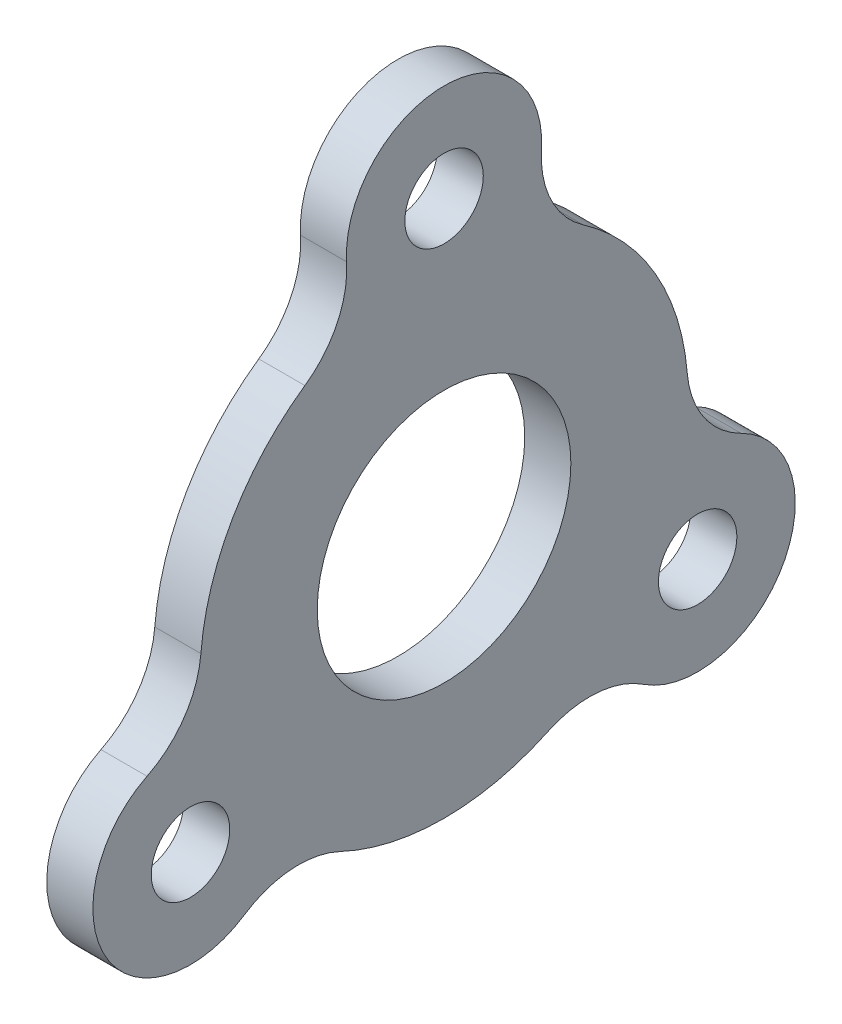
from build123d import *

# Parameters (mm, degrees)
SKETCH1_R           = 8.25000001
SKETCH1_R_2         = 2.5527
BOSS_EXTRUDE1_DEPTH = 3


with BuildPart() as part:
    # Sketch1 → Boss-Extrude1 (new body)
    with BuildSketch(Plane(origin=(0, 0, 0), x_dir=(0, 0, -1), z_dir=(1, 0, 0))):
        with BuildLine():
            ThreePointArc((-9.053693601, 13.040178571), (-13.748153285, 7.9375), (-15.819972713, 1.320639371))
            ThreePointArc((-15.819972713, 1.320639371), (-16.894607196, -1.718283796), (-19.32287287, -3.83805244))
            ThreePointArc((-19.32287287, -3.83805244), (-21.997045256, -12.7), (-12.98528735, -14.81507256))
            ThreePointArc((-12.98528735, -14.81507256), (-9.935381017, -13.77201712), (-6.766279112, -14.360817942))
            ThreePointArc((-6.766279112, -14.360817942), (0, -15.875), (6.766279112, -14.360817942))
            ThreePointArc((6.766279112, -14.360817942), (9.935381017, -13.77201712), (12.98528735, -14.81507256))
            ThreePointArc((12.98528735, -14.81507256), (21.997045256, -12.7), (19.32287287, -3.83805244))
            ThreePointArc((19.32287287, -3.83805244), (16.894607196, -1.718283796), (15.819972713, 1.320639371))
            ThreePointArc((15.819972713, 1.320639371), (13.748153285, 7.9375), (9.053693601, 13.040178571))
            ThreePointArc((9.053693601, 13.040178571), (6.959226179, 15.490300917), (6.337585521, 18.653125))
            ThreePointArc((6.337585521, 18.653125), (0, 25.4), (-6.337585521, 18.653125))
            ThreePointArc((-6.337585521, 18.653125), (-6.959226179, 15.490300917), (-9.053693601, 13.040178571))
        make_face()
        Circle(SKETCH1_R, mode=Mode.SUBTRACT)
        with Locations((0, 19.05)):
            Circle(SKETCH1_R_2, mode=Mode.SUBTRACT)
        with Locations((-16.497783942, -9.525)):
            Circle(SKETCH1_R_2, mode=Mode.SUBTRACT)
        with Locations((16.497783942, -9.525)):
            Circle(SKETCH1_R_2, mode=Mode.SUBTRACT)
    extrude(amount=BOSS_EXTRUDE1_DEPTH)


solid = part.part
